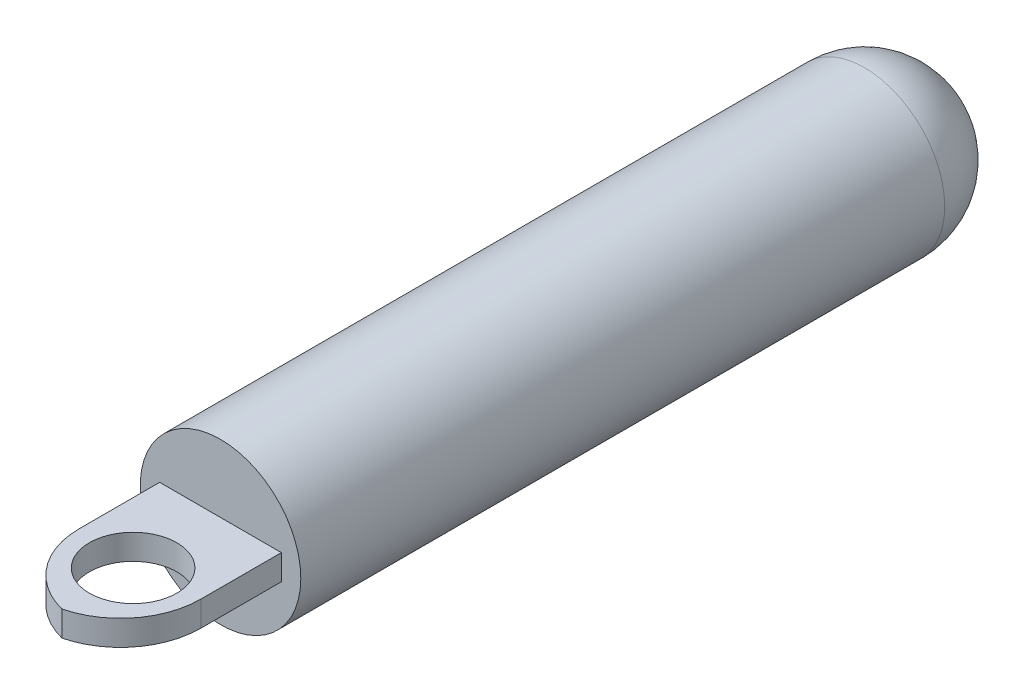
from build123d import *

# Parameters (mm, degrees)
SKETCH1_R           = 1.995
BOSS_EXTRUDE1_DEPTH = 16
DOME1_FACE_RADIUS   = 1.995
DOME1_HEIGHT        = 2
SKETCH2_W           = 3.025340216
SKETCH2_H           = 0.626677616
BOSS_EXTRUDE2_DEPTH = 4
FILLET1_R           = 2
SKETCH3_R           = 1.086514343
CUT_EXTRUDE1_DEPTH  = 4


with BuildPart() as part:
    # Sketch1 → Boss-Extrude1 (new body)
    with BuildSketch(Plane.XY):
        Circle(SKETCH1_R)
    extrude(amount=BOSS_EXTRUDE1_DEPTH)

    # Dome1: a dome of height H over a round flat face of radius A is a cap of a sphere of radius (A * A + H * H) / (2 * H)
    dome1_r = (DOME1_FACE_RADIUS * DOME1_FACE_RADIUS + DOME1_HEIGHT * DOME1_HEIGHT) / (2 * DOME1_HEIGHT)
    dome1_base = Plane((0, 0, 0), z_dir=(0, 0, -1))
    with Locations(dome1_base.offset(DOME1_HEIGHT - dome1_r)):
        dome1_ball = Sphere(dome1_r, mode=Mode.PRIVATE)
    add(split(dome1_ball, bisect_by=dome1_base, keep=Keep.TOP, mode=Mode.PRIVATE))

    # Sketch2 → Boss-Extrude2 (add)
    with BuildSketch(Plane.XY.offset(16)):
        Rectangle(SKETCH2_W, SKETCH2_H)
    extrude(amount=BOSS_EXTRUDE2_DEPTH)

    # Fillet1
    # the kernel refuses this fillet: 2 mm, written as the material it takes off along each edge
    with BuildSketch(Plane(origin=(-1.512670108, -5.313338808, 20), x_dir=(0, 0, -1), z_dir=(0, 1, 0)), Plane(origin=(1.512670108, 5.313338808, 20), x_dir=(0, 0, -1), z_dir=(0, -1, 0))) as fillet1_piece_1:
        with BuildLine():
            CenterArc((FILLET1_R, -FILLET1_R), FILLET1_R, 90, 90)
            Line((0, -FILLET1_R), (0, 0))
            Line((0, 0), (FILLET1_R, 0))
        make_face()
    extrude(amount=10.626677616, mode=Mode.SUBTRACT)

    # Sketch3 → Cut-Extrude1 (cut)
    with BuildSketch(Plane(origin=(0, 0.313338808, 0), x_dir=(1, 0, 0), z_dir=(0, 1, 0))):
        with Locations(Location((0, -18.172034212, 0), (0, 0, 270))):
            Circle(SKETCH3_R)
    extrude(amount=-CUT_EXTRUDE1_DEPTH, mode=Mode.SUBTRACT)


solid = part.part
